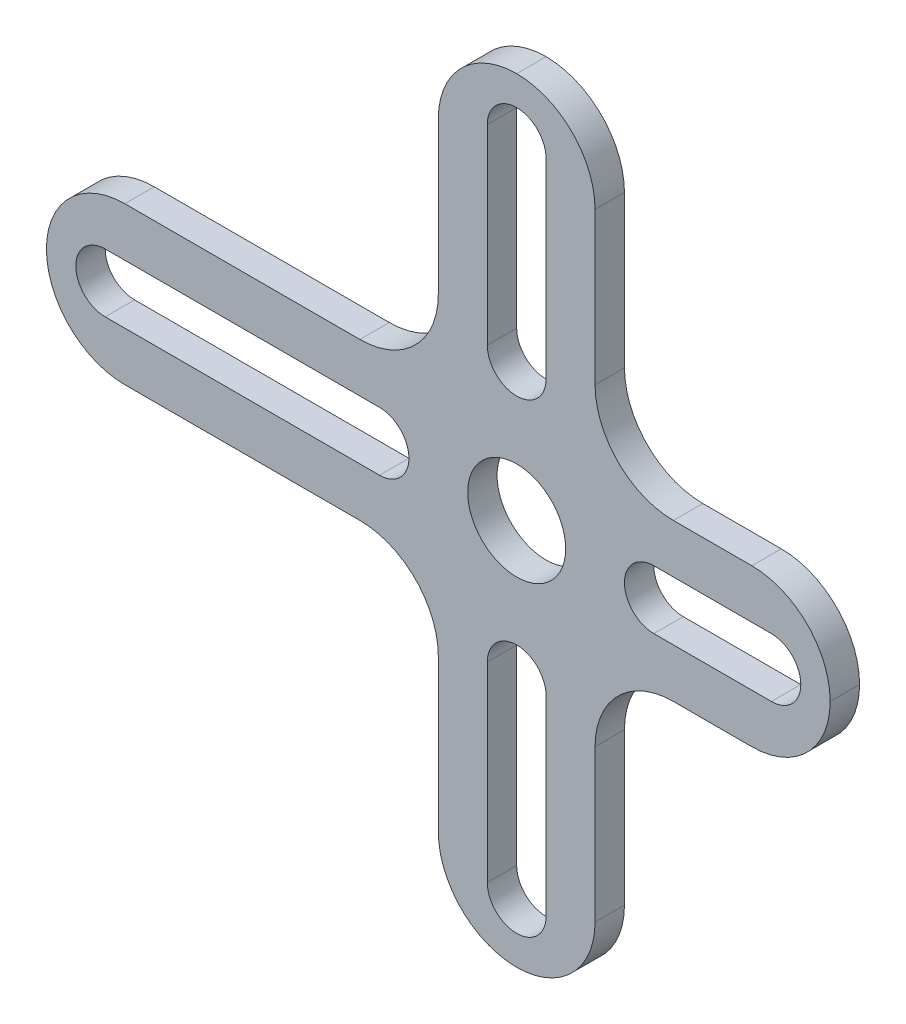
from build123d import *

# Parameters (mm, degrees)
EXTRUDE_2_DEPTH     = 1.5
FILLET_1_DEPTH      = 1.5
FILLET_1_2_DEPTH    = 1.5
SKETCH_3_R          = 2.5
CUT_EXTRUDE_2_DEPTH = 1.5
FILLET_2_R          = 4


with BuildPart() as part:
    # 草图1 → 凸台-拉伸2 (new body)
    with BuildSketch(Plane.XY):
        Polygon((-24, 4), (-4, 4), (-4, 19.75), (4, 19.75), (4, 4), (16, 4), (16, -4), (4, -4), (4, -19.75), (-4, -19.75), (-4, -4), (-24, -4), align=None)
        with BuildLine():
            Line((-21, 1.5), (-7, 1.5))
            ThreePointArc((-7, 1.5), (-5.5, 0), (-7, -1.5))
            Line((-7, -1.5), (-21, -1.5))
            ThreePointArc((-21, -1.5), (-22.5, 0), (-21, 1.5))
        make_face(mode=Mode.SUBTRACT)
        with BuildLine():
            Line((7, 1.5), (13, 1.5))
            ThreePointArc((13, 1.5), (14.5, 0), (13, -1.5))
            Line((13, -1.5), (7, -1.5))
            ThreePointArc((7, -1.5), (5.5, 0), (7, 1.5))
        make_face(mode=Mode.SUBTRACT)
        with BuildLine():
            Line((-1.5, -16.75), (-1.5, -7))
            ThreePointArc((-1.5, -7), (0, -5.5), (1.5, -7))
            Line((1.5, -7), (1.5, -16.75))
            ThreePointArc((1.5, -16.75), (0, -18.25), (-1.5, -16.75))
        make_face(mode=Mode.SUBTRACT)
        with BuildLine():
            Line((1.5, 16.75), (1.5, 7))
            ThreePointArc((1.5, 7), (0, 5.5), (-1.5, 7))
            Line((-1.5, 7), (-1.5, 16.75))
            ThreePointArc((-1.5, 16.75), (0, 18.25), (1.5, 16.75))
        make_face(mode=Mode.SUBTRACT)
    extrude(amount=EXTRUDE_2_DEPTH)

    # 圆角1: read off the stored shape, not the designer's step
    # 圆角1 outline → 圆角1 (cut)
    with BuildSketch(Plane.XY):
        with BuildLine():
            ThreePointArc((4, -15.75), (2.828427125, -18.578427125), (0, -19.75))
            Line((0, -19.75), (4, -19.75))
            Line((4, -19.75), (4, -15.75))
        make_face()
        with BuildLine():
            ThreePointArc((0, -19.75), (-2.828427125, -18.578427125), (-4, -15.75))
            Line((-4, -15.75), (-4, -19.75))
            Line((-4, -19.75), (0, -19.75))
        make_face()
        with BuildLine():
            ThreePointArc((-4, 15.75), (-2.828427125, 18.578427125), (0, 19.75))
            Line((0, 19.75), (-4, 19.75))
            Line((-4, 19.75), (-4, 15.75))
        make_face()
        with BuildLine():
            ThreePointArc((0, 19.75), (2.828427125, 18.578427125), (4, 15.75))
            Line((4, 15.75), (4, 19.75))
            Line((4, 19.75), (0, 19.75))
        make_face()
    extrude(amount=FILLET_1_DEPTH, mode=Mode.SUBTRACT)

    # Fillet 1 2 outline → Fillet 1 2 (add)
    with BuildSketch(Plane.XY):
        with BuildLine():
            Line((4, -4), (4, -8))
            ThreePointArc((4, -8), (5.171572875, -5.171572875), (8, -4))
            Line((8, -4), (4, -4))
        make_face()
        with BuildLine():
            ThreePointArc((-8, -4), (-5.171572875, -5.171572875), (-4, -8))
            Line((-4, -8), (-4, -4))
            Line((-4, -4), (-8, -4))
        make_face()
        with BuildLine():
            Line((-4, 4), (-4, 8))
            ThreePointArc((-4, 8), (-5.171572875, 5.171572875), (-8, 4))
            Line((-8, 4), (-4, 4))
        make_face()
        with BuildLine():
            ThreePointArc((8, 4), (5.171572875, 5.171572875), (4, 8))
            Line((4, 8), (4, 4))
            Line((4, 4), (8, 4))
        make_face()
    extrude(amount=FILLET_1_2_DEPTH)

    # 草图3 → 切除-拉伸2 (cut)
    with BuildSketch(Plane.XY.offset(1.5)):
        Circle(SKETCH_3_R)
    extrude(amount=-CUT_EXTRUDE_2_DEPTH, mode=Mode.SUBTRACT)

    # 圆角2
    fillet_2_edges = [part.edges().sort_by_distance(p)[0] for p in [
        (-24, -4, 0.75),
        (-24, 4, 0.75),
        (16, -4, 0.75),
        (16, 4, 0.75),
    ]]
    fillet(fillet_2_edges, radius=FILLET_2_R - 0.0001)  # a hair under: the kernel refuses the full size


solid = part.part
